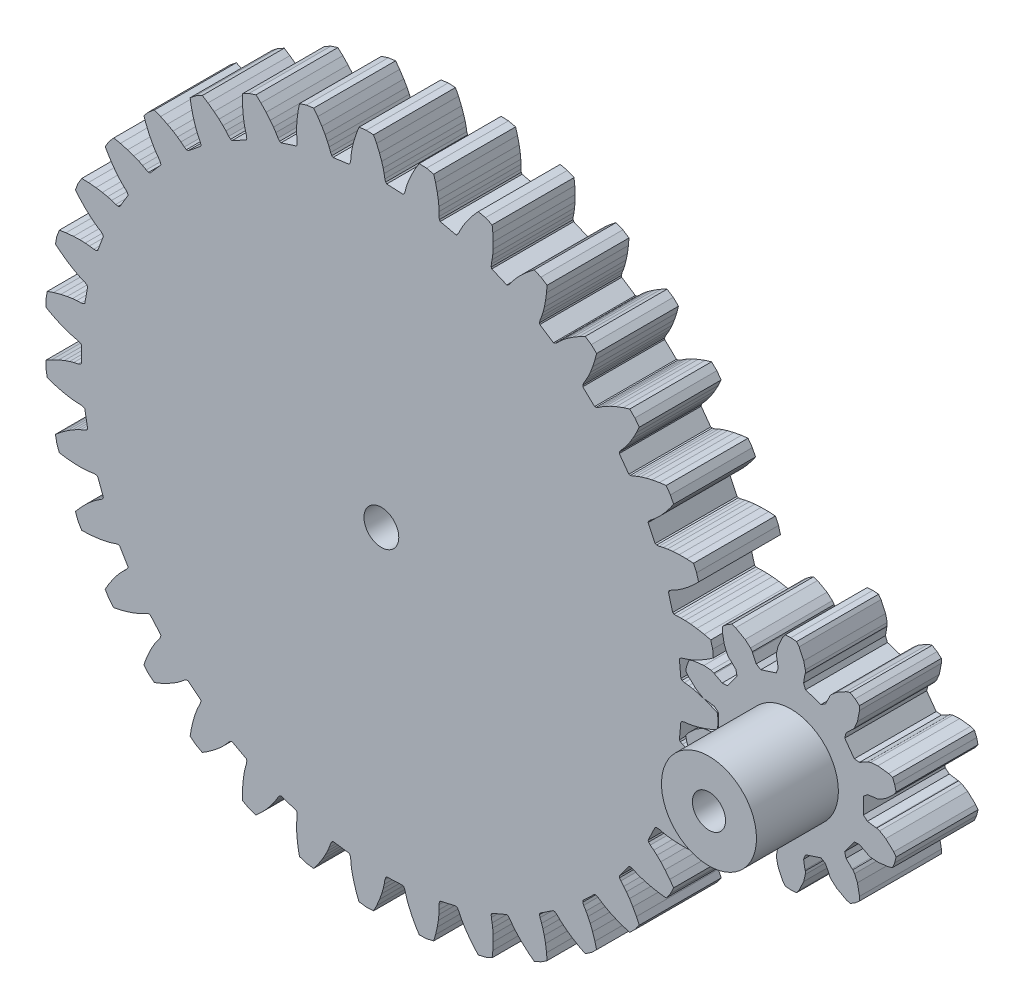
from build123d import *

# Parameters (mm, degrees)
SKETCH4_R           = 1.0795
BOSS_EXTRUDE5_DEPTH = 5.08
SKETCH4_3_R         = 1.0287
BOSS_EXTRUDE6_DEPTH = 5.08
SKETCH6_R           = 2.9464
SKETCH6_R_2         = 1.0287
BOSS_EXTRUDE8_DEPTH = 5.08


with BuildPart() as part:
    # Sketch4 → Boss-Extrude5 (new body)
    with BuildSketch(Plane.XY):
        Polygon((20.023226384, -4.265377751), (20.428130106, -4.166381845), (20.548822839, -3.729061551), (20.589489435, -3.277218655), (20.245189121, -3.042262261), (19.845505601, -2.803229757), (19.491656675, -2.619395256), (19.188601031, -2.484310387), (18.940683928, -2.391144193), (18.682003991, -2.311230459), (18.545709603, -2.242714519), (18.484360418, -2.17040021), (18.574849064, -1.164989012), (18.648124561, -1.104791144), (18.794462635, -1.061712587), (19.063254627, -1.029272186), (19.323823067, -0.981870518), (19.646128816, -0.903069194), (20.027116162, -0.785371154), (20.463057505, -0.621546249), (20.843777856, -0.451842897), (20.884444453, 0), (20.843777856, 0.451842897), (20.463057505, 0.621546249), (20.027116162, 0.785371154), (19.646128816, 0.903069194), (19.323823067, 0.981870518), (19.063254627, 1.029272186), (18.794462635, 1.061712587), (18.648124561, 1.104791144), (18.574849064, 1.164989012), (18.484360418, 2.17040021), (18.545709603, 2.242714519), (18.682003991, 2.311230459), (18.940683928, 2.391144193), (19.188601031, 2.484310387), (19.491656675, 2.619395256), (19.845505601, 2.803229757), (20.245189121, 3.042262261), (20.589489435, 3.277218655), (20.548822839, 3.729061551), (20.428130106, 4.166381845), (20.023226384, 4.265377751), (19.565038732, 4.34872959), (19.169158213, 4.396508257), (18.837961529, 4.416493298), (18.573116637, 4.416606909), (18.302851786, 4.400531316), (18.151173451, 4.416787912), (18.068326777, 4.46293453), (17.79976922, 5.436030985), (17.84722028, 5.518137493), (17.969090367, 5.609888656), (18.209344063, 5.73470723), (18.43664157, 5.870643513), (18.71070665, 6.057670187), (19.02604416, 6.301732558), (19.3766237, 6.608289959), (19.673437883, 6.900947702), (19.552745151, 7.338267996), (19.355905446, 7.747009853), (18.939832293, 7.772116503), (18.474124858, 7.772316279), (18.076075092, 7.748639926), (17.746632408, 7.709166348), (17.486023397, 7.661988253), (17.22297222, 7.597913349), (17.070828692, 7.586825481), (16.981073601, 7.61743766), (16.543078793, 8.526943251), (16.575106612, 8.616202987), (16.678635394, 8.728240415), (16.892740897, 8.893952057), (17.092113279, 9.068289326), (17.328379118, 9.301246614), (17.595070006, 9.597692489), (17.885277651, 9.961921781), (18.12506585, 10.302874611), (17.928226146, 10.711616469), (17.66156606, 11.07864259), (17.247696407, 11.029053035), (16.789437411, 10.946094328), (16.402012044, 10.851723934), (16.08491192, 10.75406045), (15.836914977, 10.661106989), (15.589532157, 10.551092194), (15.441813452, 10.513016237), (15.348034748, 10.527110075), (14.754680202, 11.343792544), (14.770255379, 11.437336628), (14.852115356, 11.566059346), (15.033191139, 11.767337948), (15.198230403, 11.974472858), (15.389103224, 12.245873321), (15.598575824, 12.585174686), (15.819084061, 12.995369239), (15.994139287, 13.373658654), (15.727479201, 13.740684775), (15.399569407, 14.054198639), (15.001205367, 13.931506728), (14.565123632, 13.768055898), (14.200774834, 13.606024605), (13.906209128, 13.453310199), (13.678795078, 13.317568975), (13.455031703, 13.165150255), (13.316485623, 13.101310001), (13.221697429, 13.098432511), (12.492054049, 13.796043012), (12.490675986, 13.890864859), (12.54823611, 14.032135614), (12.690462249, 14.262511915), (12.815863898, 14.49578698), (12.955208889, 14.796907584), (13.100730581, 15.168159014), (13.244452094, 15.611134838), (13.349147927, 16.014602303), (13.021238134, 16.328116167), (12.642617924, 16.57804118), (12.272563244, 16.386190333), (11.872674794, 16.147500824), (11.543113036, 15.92301645), (11.280549332, 15.72015949), (11.081027452, 15.545993337), (10.888075459, 15.356069555), (10.763154989, 15.268516882), (10.670403876, 15.248760549), (9.827923001, 15.804877306), (9.809635989, 15.897929264), (9.841046231, 16.047207497), (9.93985146, 16.299277013), (10.021584982, 16.551194582), (10.104923482, 16.872357063), (10.181817078, 17.26362623), (10.24413254, 17.725145718), (10.275103969, 18.140823458), (9.896483759, 18.39074847), (9.479322298, 18.569051836), (9.149470841, 18.314208297), (8.79862842, 18.007951787), (8.514446088, 17.728229445), (8.292323399, 17.48174992), (8.127106485, 17.274756681), (7.971167511, 17.053432144), (7.863887698, 16.944981068), (7.776154763, 16.908980876), (6.847914421, 17.305729839), (6.813306219, 17.394021141), (6.817557029, 17.546508927), (6.869765667, 17.812169938), (6.905204079, 18.074633171), (6.929857519, 18.405515103), (6.935651596, 18.804226295), (6.914558136, 19.26945583), (6.870809716, 19.68398362), (6.453648254, 19.862286986), (6.011353453, 19.963237888), (5.732306916, 19.653592537), (5.441786889, 19.289612362), (5.212117836, 18.963642559), (5.037575369, 18.681462524), (4.911973629, 18.448295132), (4.79805968, 18.202683392), (4.711868585, 18.076819619), (4.631973637, 18.025732645), (3.647808236, 18.250361975), (3.597991182, 18.331054867), (3.574945934, 18.481851123), (3.578879953, 18.752565064), (3.566884235, 19.017138178), (3.532060234, 19.347104743), (3.466568565, 19.740443055), (3.362744145, 20.194429777), (3.245681984, 20.594484353), (2.803387184, 20.695435255), (2.350174763, 20.715789049), (2.130901931, 20.361294143), (1.91004185, 19.951288925), (1.742267829, 19.589548597), (1.620915522, 19.280737551), (1.538965899, 19.028890198), (1.470738264, 18.766885419), (1.40840614, 18.627654314), (1.338917068, 18.563122535), (0.330458494, 18.608412462), (0.267033748, 18.678913407), (0.217433135, 18.823171417), (0.172966092, 19.09023732), (0.113921796, 19.348416717), (0.020739627, 19.666862518), (-0.113932832, 20.042185732), (-0.29715121, 20.470338135), (-0.483764637, 20.843061414), (-0.936977057, 20.863415207), (-1.386540478, 20.802517704), (-1.538991996, 20.414567001), (-1.683093506, 19.971714645), (-1.7835801, 19.585830426), (-1.847841884, 19.260313808), (-1.883505462, 18.997881076), (-1.903853891, 18.727904307), (-1.940323638, 18.579780873), (-1.997173398, 18.503878393), (-2.997512456, 18.36837326), (-3.07250637, 18.426416301), (-3.147068143, 18.559499494), (-3.238507041, 18.814333641), (-3.342702182, 19.057821223), (-3.491247569, 19.35451115), (-3.690772334, 19.69975607), (-3.947495881, 20.088312982), (-4.197662664, 20.421725331), (-4.647226085, 20.360827828), (-5.078691167, 20.220636324), (-5.159421454, 19.811698879), (-5.222132852, 19.350233024), (-5.252102296, 18.952607549), (-5.257208131, 18.620847733), (-5.245439407, 18.356264425), (-5.217254615, 18.086992941), (-5.226689818, 17.934737987), (-5.269073068, 17.849904374), (-6.22914089, 17.537959429), (-6.313293606, 17.581679014), (-6.410420062, 17.699309986), (-6.545891893, 17.933721798), (-6.691888962, 18.154691673), (-6.891023196, 18.420089868), (-7.148987376, 18.724160038), (-7.470964786, 19.060632921), (-7.77664436, 19.344018192), (-8.208109442, 19.203826689), (-8.607608544, 18.988847055), (-8.614022861, 18.572066453), (-8.593328551, 18.106818993), (-8.551817604, 17.710232271), (-8.497603383, 17.38289229), (-8.438780613, 17.124662332), (-8.362968482, 16.86475074), (-8.345065886, 16.713257865), (-8.371620393, 16.622219742), (-9.26055961, 16.143861151), (-9.35116639, 16.171852097), (-9.467735805, 16.270250093), (-9.642886394, 16.476705381), (-9.825992924, 16.668055396), (-10.069315667, 16.893631742), (-10.377428082, 17.146754096), (-10.754310736, 17.420328435), (-11.105678307, 17.644578393), (-11.505177408, 17.429598759), (-11.859870299, 17.146740617), (-11.791762486, 16.735512531), (-11.6883276, 16.2814369), (-11.576670457, 15.898635556), (-11.464878671, 15.586236386), (-11.360892468, 15.342659501), (-11.239889662, 15.100461574), (-11.19522467, 14.954599884), (-11.205096951, 14.86028329), (-11.994336324, 14.230885893), (-12.088484993, 14.242248547), (-12.22075073, 14.318250974), (-12.429950592, 14.490114095), (-12.644281389, 14.645694103), (-12.923972047, 14.824198392), (-13.27232971, 15.018237369), (-13.69200429, 15.22012026), (-14.077766615, 15.378027326), (-14.432459506, 15.095169184), (-14.730946065, 14.753523828), (-14.590505162, 14.361065466), (-14.407654183, 13.932756029), (-14.229439597, 13.576043613), (-14.063663325, 13.288626021), (-13.91785589, 13.067530969), (-13.75555154, 12.850831148), (-13.685559722, 12.715288758), (-13.678432473, 12.620725107), (-14.3426052, 11.860518253), (-14.437269741, 11.854887411), (-14.580980671, 11.906051488), (-14.81750595, 12.03779862), (-15.056172247, 12.152608152), (-15.363241332, 12.278303108), (-15.740647742, 12.407022136), (-16.18962556, 12.530724896), (-16.597383922, 12.617213808), (-16.89587048, 12.275568452), (-17.128557104, 11.886116644), (-16.920296997, 11.52504194), (-16.663906905, 11.136264916), (-16.42486284, 10.817106458), (-16.210430268, 10.563908281), (-16.027487973, 10.372401241), (-15.829098673, 10.188164436), (-15.736029624, 10.067297789), (-15.712131921, 9.975526434), (-16.229890944, 9.108943797), (-16.322028761, 9.086500439), (-16.472565896, 9.11118171), (-16.728814476, 9.198578393), (-16.98414534, 9.268927376), (-17.3087234, 9.337773059), (-17.703048403, 9.397035004), (-18.166898944, 9.438581724), (-18.583547652, 9.450872656), (-18.816234275, 9.061420849), (-18.975642223, 8.636679891), (-18.706256565, 8.318594084), (-18.384567949, 7.981845085), (-18.092377477, 7.710498601), (-17.836180644, 7.499657837), (-17.621983404, 7.343894002), (-17.39388555, 7.198041735), (-17.280730587, 7.095735585), (-17.240830522, 7.009706134), (-17.595534639, 6.064600393), (-17.682184347, 6.026065866), (-17.834709299, 6.023471056), (-18.102445139, 6.063708288), (-18.366234027, 6.087335647), (-18.697888856, 6.097119301), (-19.096458523, 6.085019434), (-19.560273248, 6.043074769), (-19.972420871, 5.980772682), (-20.131828819, 5.556031724), (-20.212834589, 5.109653139), (-19.890981655, 4.844779769), (-19.514333852, 4.570882185), (-19.178388215, 4.356068974), (-18.888661498, 4.194362219), (-18.65009379, 4.079347967), (-18.399618634, 3.976568051), (-18.270014649, 3.896110602), (-18.215394643, 3.818588111), (-18.395643373, 2.825335742), (-18.474019979, 2.771948578), (-18.623630471, 2.742161086), (-18.894248321, 2.733945609), (-19.158016841, 2.710091941), (-19.486088779, 2.660499112), (-19.876092753, 2.577426333), (-20.324964276, 2.453338419), (-20.719364049, 2.318445752), (-20.800369819, 1.872067168), (-20.800369819, 1.418397932), (-20.436394228, 1.215250247), (-20.016893008, 1.013007372), (-19.647989776, 0.861631707), (-19.334045231, 0.754256349), (-19.078774816, 0.683688332), (-18.813972837, 0.627284198), (-18.672085408, 0.571261418), (-18.604500993, 0.504737524), (-18.604500993, -0.504737524), (-18.672085408, -0.571261418), (-18.813972837, -0.627284198), (-19.078774816, -0.683688332), (-19.334045231, -0.754256349), (-19.647989776, -0.861631707), (-20.016893008, -1.013007372), (-20.436394228, -1.215250247), (-20.800369819, -1.418397932), (-20.800369819, -1.872067168), (-20.719364049, -2.318445752), (-20.324964276, -2.453338419), (-19.876092753, -2.577426333), (-19.486088779, -2.660499112), (-19.158016841, -2.710091941), (-18.894248321, -2.733945609), (-18.623630471, -2.742161086), (-18.474019979, -2.771948578), (-18.395643373, -2.825335742), (-18.215394643, -3.818588111), (-18.270014649, -3.896110602), (-18.399618634, -3.976568051), (-18.65009379, -4.079347967), (-18.888661498, -4.194362219), (-19.178388215, -4.356068974), (-19.514333852, -4.570882185), (-19.890981655, -4.844779769), (-20.212834589, -5.109653139), (-20.131828819, -5.556031724), (-19.972420871, -5.980772682), (-19.560273248, -6.043074769), (-19.096458523, -6.085019434), (-18.697888856, -6.097119301), (-18.366234027, -6.087335647), (-18.102445139, -6.063708288), (-17.834709299, -6.023471056), (-17.682184347, -6.026065866), (-17.595534639, -6.064600393), (-17.240830522, -7.009706134), (-17.280730587, -7.095735585), (-17.39388555, -7.198041735), (-17.621983404, -7.343894002), (-17.836180644, -7.499657837), (-18.092377477, -7.710498601), (-18.384567949, -7.981845085), (-18.706256565, -8.318594084), (-18.975642223, -8.636679891), (-18.816234275, -9.061420849), (-18.583547652, -9.450872656), (-18.166898944, -9.438581724), (-17.703048403, -9.397035004), (-17.3087234, -9.337773059), (-16.98414534, -9.268927376), (-16.728814476, -9.198578393), (-16.472565896, -9.11118171), (-16.322028761, -9.086500439), (-16.229890944, -9.108943797), (-15.712131921, -9.975526434), (-15.736029624, -10.067297789), (-15.829098673, -10.188164436), (-16.027487973, -10.372401241), (-16.210430268, -10.563908281), (-16.42486284, -10.817106458), (-16.663906905, -11.136264916), (-16.920296997, -11.52504194), (-17.128557104, -11.886116644), (-16.89587048, -12.275568452), (-16.597383922, -12.617213808), (-16.18962556, -12.530724896), (-15.740647742, -12.407022136), (-15.363241332, -12.278303108), (-15.056172247, -12.152608152), (-14.81750595, -12.03779862), (-14.580980671, -11.906051488), (-14.437269741, -11.854887411), (-14.3426052, -11.860518253), (-13.678432473, -12.620725107), (-13.685559722, -12.715288758), (-13.75555154, -12.850831148), (-13.91785589, -13.067530969), (-14.063663325, -13.288626021), (-14.229439597, -13.576043613), (-14.407654183, -13.932756029), (-14.590505162, -14.361065466), (-14.730946065, -14.753523828), (-14.432459506, -15.095169184), (-14.077766615, -15.378027326), (-13.69200429, -15.22012026), (-13.27232971, -15.018237369), (-12.923972047, -14.824198392), (-12.644281389, -14.645694103), (-12.429950592, -14.490114095), (-12.22075073, -14.318250974), (-12.088484993, -14.242248547), (-11.994336324, -14.230885893), (-11.205096951, -14.86028329), (-11.19522467, -14.954599884), (-11.239889662, -15.100461574), (-11.360892468, -15.342659501), (-11.464878671, -15.586236386), (-11.576670457, -15.898635556), (-11.6883276, -16.2814369), (-11.791762486, -16.735512531), (-11.859870299, -17.146740617), (-11.505177408, -17.429598759), (-11.105678307, -17.644578393), (-10.754310736, -17.420328435), (-10.377428082, -17.146754096), (-10.069315667, -16.893631742), (-9.825992924, -16.668055396), (-9.642886394, -16.476705381), (-9.467735805, -16.270250093), (-9.35116639, -16.171852097), (-9.26055961, -16.143861151), (-8.371620393, -16.622219742), (-8.345065886, -16.713257865), (-8.362968482, -16.86475074), (-8.438780613, -17.124662332), (-8.497603383, -17.38289229), (-8.551817604, -17.710232271), (-8.593328551, -18.106818993), (-8.614022861, -18.572066453), (-8.607608544, -18.988847055), (-8.208109442, -19.203826689), (-7.77664436, -19.344018192), (-7.470964786, -19.060632921), (-7.148987376, -18.724160038), (-6.891023196, -18.420089868), (-6.691888962, -18.154691673), (-6.545891893, -17.933721798), (-6.410420062, -17.699309986), (-6.313293606, -17.581679014), (-6.22914089, -17.537959429), (-5.269073068, -17.849904374), (-5.226689818, -17.934737987), (-5.217254615, -18.086992941), (-5.245439407, -18.356264425), (-5.257208131, -18.620847733), (-5.252102296, -18.952607549), (-5.222132852, -19.350233024), (-5.159421454, -19.811698879), (-5.078691167, -20.220636324), (-4.647226085, -20.360827828), (-4.197662664, -20.421725331), (-3.947495881, -20.088312982), (-3.690772334, -19.69975607), (-3.491247569, -19.35451115), (-3.342702182, -19.057821223), (-3.238507041, -18.814333641), (-3.147068143, -18.559499494), (-3.07250637, -18.426416301), (-2.997512456, -18.36837326), (-1.997173398, -18.503878393), (-1.940323638, -18.579780873), (-1.903853891, -18.727904307), (-1.883505462, -18.997881076), (-1.847841884, -19.260313808), (-1.7835801, -19.585830426), (-1.683093506, -19.971714645), (-1.538991996, -20.414567001), (-1.386540478, -20.802517704), (-0.936977057, -20.863415207), (-0.483764637, -20.843061414), (-0.29715121, -20.470338135), (-0.113932832, -20.042185732), (0.020739627, -19.666862518), (0.113921796, -19.348416717), (0.172966092, -19.09023732), (0.217433135, -18.823171417), (0.267033748, -18.678913407), (0.330458494, -18.608412462), (1.338917068, -18.563122535), (1.40840614, -18.627654314), (1.470738264, -18.766885419), (1.538965899, -19.028890198), (1.620915522, -19.280737551), (1.742267829, -19.589548597), (1.91004185, -19.951288925), (2.130901931, -20.361294143), (2.350174763, -20.715789049), (2.803387184, -20.695435255), (3.245681984, -20.594484353), (3.362744145, -20.194429777), (3.466568565, -19.740443055), (3.532060234, -19.347104743), (3.566884235, -19.017138178), (3.578879953, -18.752565064), (3.574945934, -18.481851123), (3.597991182, -18.331054867), (3.647808236, -18.250361975), (4.631973637, -18.025732645), (4.711868585, -18.076819619), (4.79805968, -18.202683392), (4.911973629, -18.448295132), (5.037575369, -18.681462524), (5.212117836, -18.963642559), (5.441786889, -19.289612362), (5.732306916, -19.653592537), (6.011353453, -19.963237888), (6.453648254, -19.862286986), (6.870809716, -19.68398362), (6.914558136, -19.26945583), (6.935651596, -18.804226295), (6.929857519, -18.405515103), (6.905204079, -18.074633171), (6.869765667, -17.812169938), (6.817557029, -17.546508927), (6.813306219, -17.394021141), (6.847914421, -17.305729839), (7.776154763, -16.908980876), (7.863887698, -16.944981068), (7.971167511, -17.053432144), (8.127106485, -17.274756681), (8.292323399, -17.48174992), (8.514446088, -17.728229445), (8.79862842, -18.007951787), (9.149470841, -18.314208297), (9.479322298, -18.569051836), (9.896483759, -18.39074847), (10.275103969, -18.140823458), (10.24413254, -17.725145718), (10.181817078, -17.26362623), (10.104923482, -16.872357063), (10.021584982, -16.551194582), (9.93985146, -16.299277013), (9.841046231, -16.047207497), (9.809635989, -15.897929264), (9.827923001, -15.804877306), (10.670403876, -15.248760549), (10.763154989, -15.268516882), (10.888075459, -15.356069555), (11.081027452, -15.545993337), (11.280549332, -15.72015949), (11.543113036, -15.92301645), (11.872674794, -16.147500824), (12.272563244, -16.386190333), (12.642617924, -16.57804118), (13.021238134, -16.328116167), (13.349147927, -16.014602303), (13.244452094, -15.611134838), (13.100730581, -15.168159014), (12.955208889, -14.796907584), (12.815863898, -14.49578698), (12.690462249, -14.262511915), (12.54823611, -14.032135614), (12.490675986, -13.890864859), (12.492054049, -13.796043012), (13.221697429, -13.098432511), (13.316485623, -13.101310001), (13.455031703, -13.165150255), (13.678795078, -13.317568975), (13.906209128, -13.453310199), (14.200774834, -13.606024605), (14.565123632, -13.768055898), (15.001205367, -13.931506728), (15.399569407, -14.054198639), (15.727479201, -13.740684775), (15.994139287, -13.373658654), (15.819084061, -12.995369239), (15.598575824, -12.585174686), (15.389103224, -12.245873321), (15.198230403, -11.974472858), (15.033191139, -11.767337948), (14.852115356, -11.566059346), (14.770255379, -11.437336628), (14.754680202, -11.343792544), (15.348034748, -10.527110075), (15.441813452, -10.513016237), (15.589532157, -10.551092194), (15.836914977, -10.661106989), (16.08491192, -10.75406045), (16.402012044, -10.851723934), (16.789437411, -10.946094328), (17.247696407, -11.029053035), (17.66156606, -11.07864259), (17.928226146, -10.711616469), (18.12506585, -10.302874611), (17.885277651, -9.961921781), (17.595070006, -9.597692489), (17.328379118, -9.301246614), (17.092113279, -9.068289326), (16.892740897, -8.893952057), (16.678635394, -8.728240415), (16.575106612, -8.616202987), (16.543078793, -8.526943251), (16.981073601, -7.61743766), (17.070828692, -7.586825481), (17.22297222, -7.597913349), (17.486023397, -7.661988253), (17.746632408, -7.709166348), (18.076075092, -7.748639926), (18.474124858, -7.772316279), (18.939832293, -7.772116503), (19.355905446, -7.747009853), (19.552745151, -7.338267996), (19.673437883, -6.900947702), (19.3766237, -6.608289959), (19.02604416, -6.301732558), (18.71070665, -6.057670187), (18.43664157, -5.870643513), (18.209344063, -5.73470723), (17.969090367, -5.609888656), (17.84722028, -5.518137493), (17.79976922, -5.436030985), (18.068326777, -4.46293453), (18.151173451, -4.416787912), (18.302851786, -4.400531316), (18.573116637, -4.416606909), (18.837961529, -4.416493298), (19.169158213, -4.396508257), (19.565038732, -4.34872959), align=None)
        Circle(SKETCH4_R, mode=Mode.SUBTRACT)
    extrude(amount=BOSS_EXTRUDE5_DEPTH)


with BuildPart() as body_2:
    # Sketch4<3> → Boss-Extrude6 (new body)
    with BuildSketch(Plane.XY):
        Polygon((19.338406177, 2.505414175), (19.09440633, 2.421961313), (18.958177204, 2.093075109), (18.875074422, 1.746927111), (19.023422083, 1.535992815), (19.518430519, 1.07629679), (19.896402829, 0.850248771), (20.076199054, 0.788754841), (20.128125399, 0.793405842), (20.654073755, 0.715815948), (20.906610134, 0.504737524), (20.906610134, -0.504737524), (20.654073755, -0.715815948), (20.128125399, -0.793405842), (20.076199054, -0.788754841), (19.896402829, -0.850248771), (19.518430519, -1.07629679), (19.023422083, -1.535992815), (18.875074422, -1.746927111), (18.958177204, -2.093075109), (19.09440633, -2.421961313), (19.338406177, -2.505414175), (20.009078958, -2.586357413), (20.447732672, -2.547067552), (20.629336099, -2.491135618), (20.668611605, -2.456851339), (21.139718958, -2.210478195), (21.468093966, -2.232807067), (22.061448511, -3.049489536), (21.981211073, -3.368692728), (21.60131611, -3.740608958), (21.556573025, -3.767367759), (21.447260049, -3.922798963), (21.274341718, -4.327842201), (21.144074025, -4.990702757), (21.148042315, -5.248548754), (21.418734566, -5.479741777), (21.722260704, -5.665742834), (21.968713089, -5.589838106), (22.558876008, -5.261110992), (22.890660316, -4.971490643), (23.004704609, -4.819496941), (23.016327367, -4.768674814), (23.252646721, -4.292444798), (23.531432265, -4.117495249), (24.491500087, -4.429440194), (24.614209565, -4.734843384), (24.525474959, -5.259026591), (24.505005471, -5.306974241), (24.507929585, -5.496973282), (24.606114159, -5.92629899), (24.89034504, -6.539133873), (25.045113529, -6.745403164), (25.40000001, -6.773333336), (25.754886492, -6.745403164), (25.90965498, -6.539133873), (26.193885861, -5.92629899), (26.292070435, -5.496973282), (26.294994549, -5.306974241), (26.274525062, -5.259026591), (26.185790455, -4.734843384), (26.308499933, -4.429440194), (27.268567755, -4.117495249), (27.547353299, -4.292444798), (27.783672653, -4.768674814), (27.795295411, -4.819496941), (27.909339704, -4.971490643), (28.241124012, -5.261110992), (28.831286932, -5.589838106), (29.077739316, -5.665742834), (29.381265454, -5.479741777), (29.651957706, -5.248548754), (29.655925995, -4.990702757), (29.525658302, -4.327842201), (29.352739972, -3.922798963), (29.243426996, -3.767367759), (29.19868391, -3.740608958), (28.818788947, -3.368692728), (28.738551509, -3.049489536), (29.331906055, -2.232807067), (29.660281062, -2.210478195), (30.131388416, -2.456851339), (30.170663922, -2.491135618), (30.352267349, -2.547067552), (30.790921063, -2.586357413), (31.461593844, -2.505414175), (31.705593691, -2.421961313), (31.841822817, -2.093075109), (31.924925599, -1.746927111), (31.776577938, -1.535992815), (31.281569502, -1.07629679), (30.903597192, -0.850248771), (30.723800967, -0.788754841), (30.671874622, -0.793405842), (30.145926266, -0.715815948), (29.893389886, -0.504737524), (29.893389886, 0.504737524), (30.145926266, 0.715815948), (30.671874622, 0.793405842), (30.723800967, 0.788754841), (30.903597192, 0.850248771), (31.281569502, 1.07629679), (31.776577938, 1.535992815), (31.924925599, 1.746927111), (31.841822817, 2.093075109), (31.705593691, 2.421961313), (31.461593844, 2.505414175), (30.790921063, 2.586357413), (30.352267349, 2.547067552), (30.170663922, 2.491135618), (30.131388416, 2.456851339), (29.660281062, 2.210478195), (29.331906055, 2.232807067), (28.738551509, 3.049489536), (28.818788947, 3.368692728), (29.19868391, 3.740608958), (29.243426996, 3.767367759), (29.352739972, 3.922798963), (29.525658302, 4.327842201), (29.655925995, 4.990702757), (29.651957706, 5.248548754), (29.381265454, 5.479741777), (29.077739316, 5.665742834), (28.831286932, 5.589838106), (28.241124012, 5.261110992), (27.909339704, 4.971490643), (27.795295411, 4.819496941), (27.783672653, 4.768674814), (27.547353299, 4.292444798), (27.268567755, 4.117495249), (26.308499933, 4.429440194), (26.185790455, 4.734843384), (26.274525062, 5.259026591), (26.294994549, 5.306974241), (26.292070435, 5.496973282), (26.193885861, 5.92629899), (25.90965498, 6.539133873), (25.754886492, 6.745403164), (25.40000001, 6.773333336), (25.045113529, 6.745403164), (24.89034504, 6.539133873), (24.606114159, 5.92629899), (24.507929585, 5.496973282), (24.505005471, 5.306974241), (24.525474959, 5.259026591), (24.614209565, 4.734843384), (24.491500087, 4.429440194), (23.531432265, 4.117495249), (23.252646721, 4.292444798), (23.016327367, 4.768674814), (23.004704609, 4.819496941), (22.890660316, 4.971490643), (22.558876008, 5.261110992), (21.968713089, 5.589838106), (21.722260704, 5.665742834), (21.418734566, 5.479741777), (21.148042315, 5.248548754), (21.144074025, 4.990702757), (21.274341718, 4.327842201), (21.447260049, 3.922798963), (21.556573025, 3.767367759), (21.60131611, 3.740608958), (21.981211073, 3.368692728), (22.061448511, 3.049489536), (21.468093966, 2.232807067), (21.139718958, 2.210478195), (20.668611605, 2.456851339), (20.629336099, 2.491135618), (20.447732672, 2.547067552), (20.009078958, 2.586357413), align=None)
        with Locations((25.40000001, 0)):
            Circle(SKETCH4_3_R, mode=Mode.SUBTRACT)
    extrude(amount=BOSS_EXTRUDE6_DEPTH)

    # Sketch6 → Boss-Extrude8 (add)
    with BuildSketch(Plane.XY.offset(5.08)):
        with Locations((25.40000001, 0)):
            Circle(SKETCH6_R)
        with Locations((25.40000001, 0)):
            Circle(SKETCH6_R_2, mode=Mode.SUBTRACT)
    extrude(amount=BOSS_EXTRUDE8_DEPTH)


solid = Compound([part.part, body_2.part])
